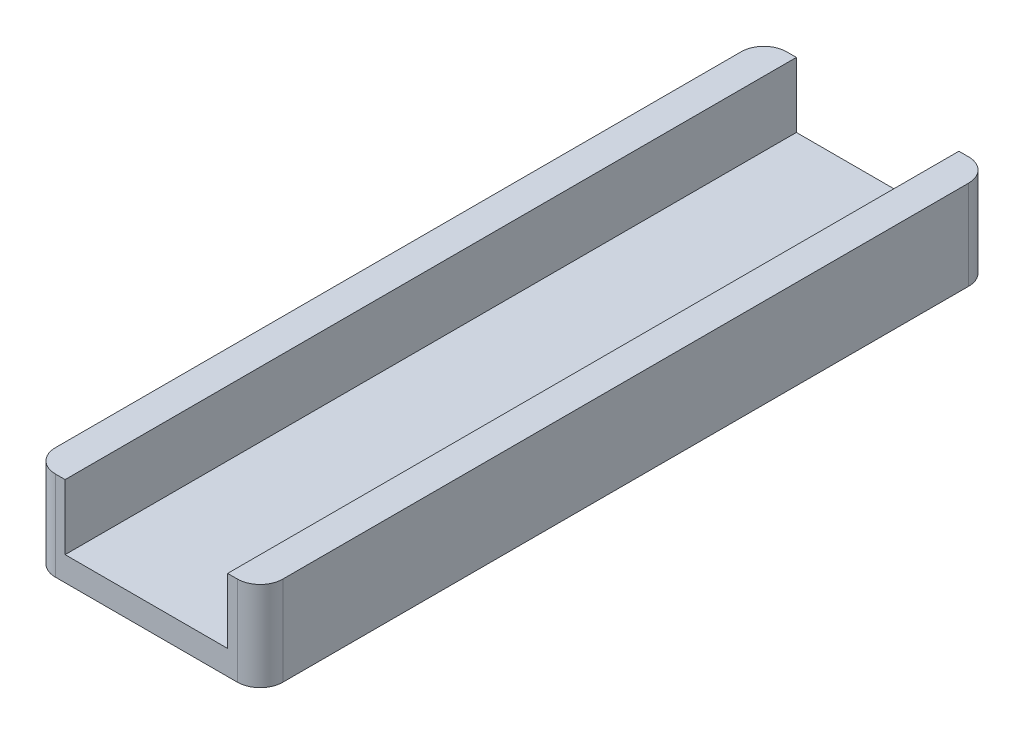
from build123d import *

# Parameters (mm, degrees)
SKETCH_1_W      = 14
SKETCH_1_H      = 45
EXTRUDE_1_DEPTH = 1.5
SKETCH_2_W      = 2
SKETCH_2_H      = 45
EXTRUDE_2_DEPTH = 4
FILLET_1_R      = 1.4


with BuildPart() as part:
    # 草图1 → 凸台-拉伸1 (new body)
    with BuildSketch(Plane(origin=(0, 0, 0), x_dir=(1, 0, 0), z_dir=(0, 1, 0))):
        with Locations((7, 22.5)):
            Rectangle(SKETCH_1_W, SKETCH_1_H)
    extrude(amount=EXTRUDE_1_DEPTH)

    # 草图2 → 凸台-拉伸2 (add)
    with BuildSketch(Plane(origin=(0, 1.5, 0), x_dir=(1, 0, 0), z_dir=(0, 1, 0))):
        with Locations((1, 22.5)):
            Rectangle(SKETCH_2_W, SKETCH_2_H)
        with Locations((13, 22.5)):
            Rectangle(SKETCH_2_W, SKETCH_2_H)
    extrude(amount=EXTRUDE_2_DEPTH)

    # 圆角1
    fillet_1_edges = [part.edges().sort_by_distance(p)[0] for p in [
        (14, 2.75, 0),
        (0, 2.75, 0),
        (14, 2.75, -45),
        (0, 2.75, -45),
    ]]
    fillet(fillet_1_edges, radius=FILLET_1_R)


solid = part.part
